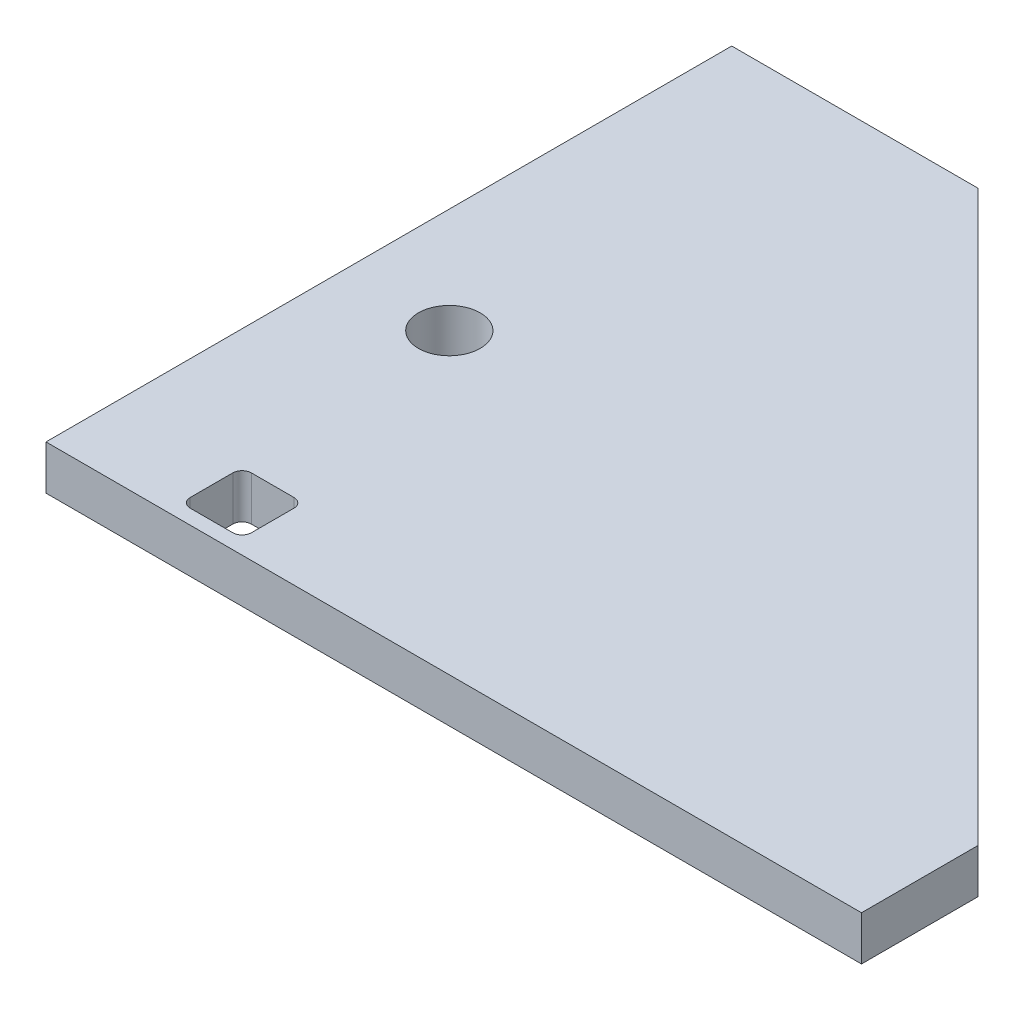
from build123d import *

# Parameters (mm, degrees)
BOSS_EXTRUDE1_DEPTH = 38.1
SKETCH2_R           = 26.5
CUT_EXTRUDE1_DEPTH  = 459.875847071
CUT_EXTRUDE2_DEPTH  = 459.875847071


with BuildPart() as part:
    # Sketch1 → Boss-Extrude1 (new body)
    with BuildSketch(Plane(origin=(0, 0, 0), x_dir=(1, 0, 0), z_dir=(0, 1, 0))):
        Polygon((-138.61, 294.305), (350, -194.305), (350, -294.305), (-350, -294.305), (-350, 294.305), align=None)
    extrude(amount=BOSS_EXTRUDE1_DEPTH)

    # Sketch2 → Cut-Extrude1 (cut, through all)
    with BuildSketch(Plane(origin=(0, 0, 0), x_dir=(-1, 0, 0), z_dir=(0, -1, 0))):
        with Locations((259.646818389, -38.480189194)):
            Circle(SKETCH2_R)
    extrude(amount=-CUT_EXTRUDE1_DEPTH, mode=Mode.SUBTRACT)

    # Sketch3 → Cut-Extrude2 (cut, through all)
    with BuildSketch(Plane.XZ):
        with BuildLine():
            Line((-194.317185165, 237.169182938), (-194.317185165, 273.669182938))
            ThreePointArc((-194.317185165, 273.669182938), (-196.660330915, 279.326037187), (-202.317185165, 281.669182938))
            Line((-202.317185165, 281.669182938), (-238.817185165, 281.669182938))
            ThreePointArc((-238.817185165, 281.669182938), (-244.474039414, 279.326037187), (-246.817185165, 273.669182938))
            Line((-246.817185165, 273.669182938), (-246.817185165, 237.169182938))
            ThreePointArc((-246.817185165, 237.169182938), (-244.474039414, 231.512328688), (-238.817185165, 229.169182938))
            Line((-238.817185165, 229.169182938), (-202.317185165, 229.169182938))
            ThreePointArc((-202.317185165, 229.169182938), (-196.660330915, 231.512328688), (-194.317185165, 237.169182938))
        make_face()
    extrude(amount=-CUT_EXTRUDE2_DEPTH, mode=Mode.SUBTRACT)


solid = part.part
